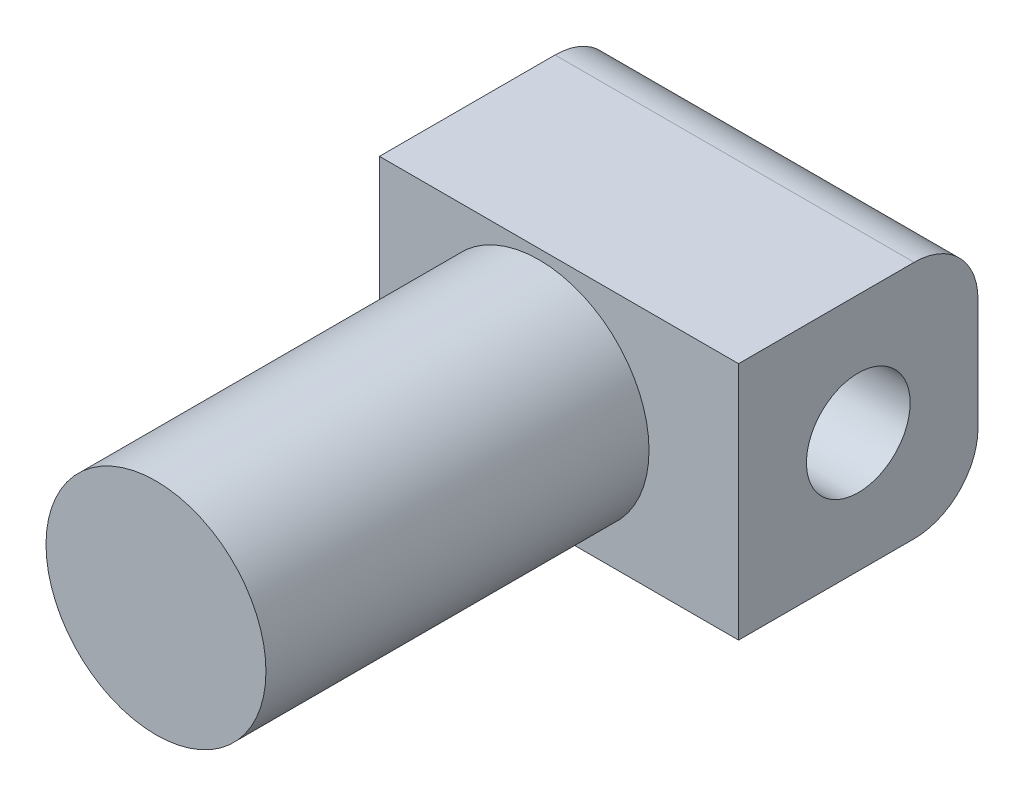
from build123d import *

# Parameters (mm, degrees)
SKETCH1_W                   = 7.62
SKETCH1_H                   = 11.43
BOSS_EXTRUDE1_DEPTH         = 7.62
SKETCH2_R                   = 3.499999985
BOSS_EXTRUDE2_DEPTH         = 12.192
TAP_DRILL_FOR_M4X0_7_TAP1_D = 3.3
FILLET1_R                   = 2.032


with BuildPart() as part:
    # Sketch1 → Boss-Extrude1 (new body)
    with BuildSketch(Plane(origin=(0, 0, 0), x_dir=(0, 1, 0), z_dir=(0, 0, 1))):
        with Locations((-3.81, 5.715)):
            Rectangle(SKETCH1_W, SKETCH1_H)
    extrude(amount=BOSS_EXTRUDE1_DEPTH)

    # Sketch2 → Boss-Extrude2 (add)
    with BuildSketch(Plane.XY.offset(7.62)):
        with Locations((-6.35, -3.81)):
            Circle(SKETCH2_R)
    extrude(amount=BOSS_EXTRUDE2_DEPTH)

    # Tap Drill for M4x0.7 Tap1 (through all)
    with Locations(Plane(origin=(0, 0, 0), x_dir=(0, 0, -1), z_dir=(1, 0, 0))):
        with Locations((-3.81, -3.81)):
            Hole(TAP_DRILL_FOR_M4X0_7_TAP1_D / 2)

    # Fillet1
    fillet1_edges = [part.edges().sort_by_distance(p)[0] for p in [
        (-5.715, 0, 0),
        (-5.715, -7.62, 0),
    ]]
    fillet(fillet1_edges, radius=FILLET1_R)


solid = part.part
